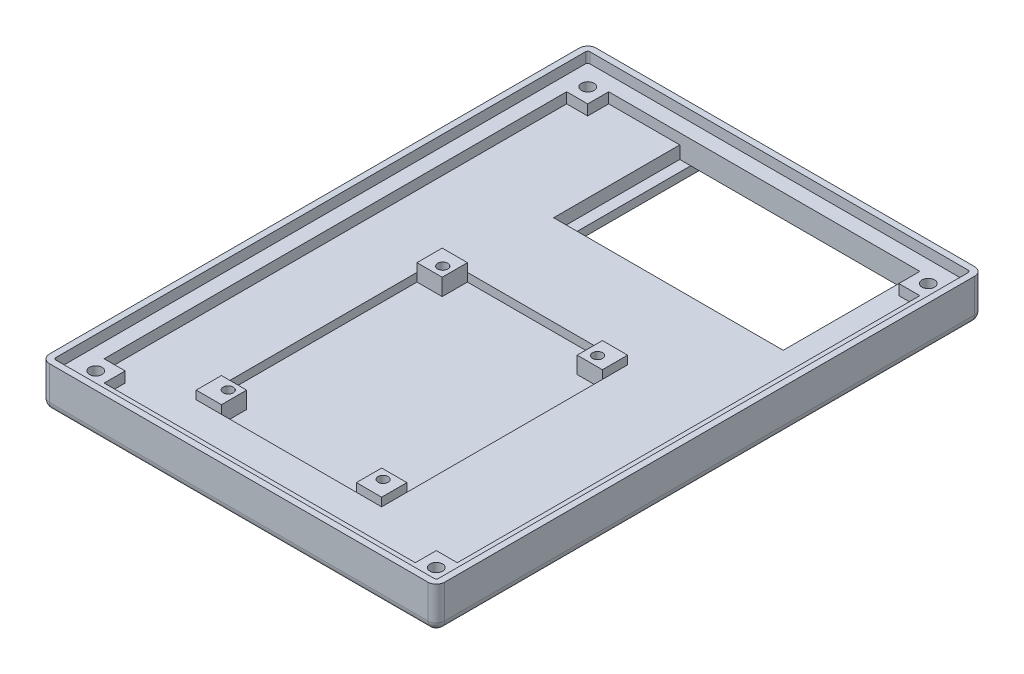
from build123d import *

# Parameters (mm, degrees)
SKETCH1_W           = 94
SKETCH1_H           = 130
BOSS_EXTRUDE1_DEPTH = 5
SKETCH2_W           = 94
SKETCH2_H           = 130
SKETCH2_W_2         = 84
SKETCH2_H_2         = 120
BOSS_EXTRUDE2_DEPTH = 5
FILLET1_R           = 2
SKETCH3_W           = 44.1
SKETCH3_H           = 58.5
CUT_EXTRUDE1_DEPTH  = 2
SKETCH5_W           = 6
SKETCH5_H           = 6
BOSS_EXTRUDE4_DEPTH = 4
SKETCH7_R           = 1.20000014
CUT_EXTRUDE2_DEPTH  = 3
SKETCH8_W           = 54.6
SKETCH8_H           = 30
CUT_EXTRUDE3_DEPTH  = 3
SKETCH9_W           = 49.4
SKETCH9_H           = 27
CUT_EXTRUDE4_DEPTH  = 2
SKETCH10_W          = 49.4
SKETCH10_H          = 6.619549161
CUT_EXTRUDE5_DEPTH  = 2
SKETCH11_W          = 5
SKETCH11_H          = 1
CUT_EXTRUDE6_DEPTH  = 3
SKETCH14_W          = 84
SKETCH14_H          = 120
CUT_EXTRUDE8_DEPTH  = 2.5
SKETCH15_W          = 5
SKETCH15_H          = 5
BOSS_EXTRUDE5_DEPTH = 2.5
SKETCH16_R          = 1.5
CUT_EXTRUDE9_DEPTH  = 161.599657534
SKETCH17_R          = 2.8
CUT_EXTRUDE10_DEPTH = 3


with BuildPart() as part:
    # Sketch1 → Boss-Extrude1 (new body)
    with BuildSketch(Plane(origin=(0, 0, 0), x_dir=(1, 0, 0), z_dir=(0, 1, 0))):
        with Locations((47, 65)):
            Rectangle(SKETCH1_W, SKETCH1_H)
    extrude(amount=BOSS_EXTRUDE1_DEPTH)

    # Sketch2 → Boss-Extrude2 (add)
    with BuildSketch(Plane(origin=(0, 5, 0), x_dir=(1, 0, 0), z_dir=(0, 1, 0))):
        with Locations((47, 65)):
            Rectangle(SKETCH2_W, SKETCH2_H)
        with Locations((47, 65)):
            Rectangle(SKETCH2_W_2, SKETCH2_H_2, mode=Mode.SUBTRACT)
    extrude(amount=BOSS_EXTRUDE2_DEPTH)

    # Fillet1
    fillet1_edges = [part.edges().sort_by_distance(p)[0] for p in [
        (0, 5, -130),
        (0, 5, 0),
        (94, 5, 0),
        (47, 0, 0),
        (0, 0, -65),
        (94, 0, -65),
        (47, 0, -130),
        (94, 5, -130),
    ]]
    fillet(fillet1_edges, radius=FILLET1_R)

    # Sketch3 → Cut-Extrude1 (cut)
    with BuildSketch(Plane(origin=(0, 5, 0), x_dir=(1, 0, 0), z_dir=(0, 1, 0))):
        with Locations((43.95, 44.25)):
            Rectangle(SKETCH3_W, SKETCH3_H)
    extrude(amount=-CUT_EXTRUDE1_DEPTH, mode=Mode.SUBTRACT)

    # Sketch5 → Boss-Extrude4 (add)
    with BuildSketch(Plane(origin=(0, 3, 0), x_dir=(1, 0, 0), z_dir=(0, 1, 0))):
        with Locations((24.9, 70.5)):
            Rectangle(SKETCH5_W, SKETCH5_H)
        with Locations((63, 70.5)):
            Rectangle(SKETCH5_W, SKETCH5_H)
        with Locations((63, 18)):
            Rectangle(SKETCH5_W, SKETCH5_H)
        with Locations((24.9, 18)):
            Rectangle(SKETCH5_W, SKETCH5_H)
    extrude(amount=BOSS_EXTRUDE4_DEPTH)

    # Sketch7 → Cut-Extrude2 (cut)
    with BuildSketch(Plane(origin=(0, 7, 0), x_dir=(1, 0, 0), z_dir=(0, 1, 0))):
        with Locations((25.684600549, 69.839000092)):
            Circle(SKETCH7_R)
        with Locations((62.514600549, 69.839000092)):
            Circle(SKETCH7_R)
        with Locations((62.514600549, 18.835800092)):
            Circle(SKETCH7_R)
        with Locations((25.684600549, 18.835800092)):
            Circle(SKETCH7_R)
    extrude(amount=-CUT_EXTRUDE2_DEPTH, mode=Mode.SUBTRACT)

    # Sketch8 → Cut-Extrude3 (cut)
    with BuildSketch(Plane(origin=(0, 5, 0), x_dir=(1, 0, 0), z_dir=(0, 1, 0))):
        with Locations((54.2, 110)):
            Rectangle(SKETCH8_W, SKETCH8_H)
    extrude(amount=-CUT_EXTRUDE3_DEPTH, mode=Mode.SUBTRACT)

    # Sketch9 → Cut-Extrude4 (cut)
    with BuildSketch(Plane(origin=(0, 2, 0), x_dir=(1, 0, 0), z_dir=(0, 1, 0))):
        with Locations((54.2, 110)):
            Rectangle(SKETCH9_W, SKETCH9_H)
    extrude(amount=-CUT_EXTRUDE4_DEPTH, mode=Mode.SUBTRACT)

    # Sketch10 → Cut-Extrude5 (cut)
    with BuildSketch(Plane.XZ):
        with Locations((54.2, -126.809774581)):
            Rectangle(SKETCH10_W, SKETCH10_H)
    extrude(amount=-CUT_EXTRUDE5_DEPTH, mode=Mode.SUBTRACT)

    # Sketch11 → Cut-Extrude6 (cut)
    with BuildSketch(Plane(origin=(0, 0, -96.5), x_dir=(-1, 0, 0), z_dir=(0, 0, -1))):
        with Locations((-54.2, 1)):
            Rectangle(SKETCH11_W, SKETCH11_H)
    extrude(amount=-CUT_EXTRUDE6_DEPTH, mode=Mode.SUBTRACT)

    # Sketch14 → Cut-Extrude8 (cut)
    with BuildSketch(Plane(origin=(0, 10, 0), x_dir=(1, 0, 0), z_dir=(0, 1, 0))):
        with BuildLine():
            Line((92.5, 2), (92.5, 128))
            ThreePointArc((92.5, 128), (92.353553391, 128.353553391), (92, 128.5))
            Line((92, 128.5), (2, 128.5))
            ThreePointArc((2, 128.5), (1.646446609, 128.353553391), (1.5, 128))
            Line((1.5, 128), (1.5, 2))
            ThreePointArc((1.5, 2), (1.646446609, 1.646446609), (2, 1.5))
            Line((2, 1.5), (92, 1.5))
            ThreePointArc((92, 1.5), (92.353553391, 1.646446609), (92.5, 2))
        make_face()
        with Locations((47, 65)):
            Rectangle(SKETCH14_W, SKETCH14_H, mode=Mode.SUBTRACT)
    extrude(amount=-CUT_EXTRUDE8_DEPTH, mode=Mode.SUBTRACT)

    # Sketch15 → Boss-Extrude5 (add)
    with BuildSketch(Plane(origin=(0, 5, 0), x_dir=(1, 0, 0), z_dir=(0, 1, 0))):
        with Locations((86.5, 122.5)):
            Rectangle(SKETCH15_W, SKETCH15_H)
        with Locations((7.5, 122.5)):
            Rectangle(SKETCH15_W, SKETCH15_H)
        with Locations((7.5, 7.5)):
            Rectangle(SKETCH15_W, SKETCH15_H)
        with Locations((86.5, 7.5)):
            Rectangle(SKETCH15_W, SKETCH15_H)
    extrude(amount=BOSS_EXTRUDE5_DEPTH)

    # Sketch16 → Cut-Extrude9 (cut, through all)
    with BuildSketch(Plane(origin=(0, 7.5, 0), x_dir=(1, 0, 0), z_dir=(0, 1, 0))):
        with Locations((6.5, 123.5)):
            Circle(SKETCH16_R)
        with Locations((87.5, 123.5)):
            Circle(SKETCH16_R)
        with Locations((87.5, 6.5)):
            Circle(SKETCH16_R)
        with Locations((6.5, 6.5)):
            Circle(SKETCH16_R)
    extrude(amount=-CUT_EXTRUDE9_DEPTH, mode=Mode.SUBTRACT)

    # Sketch17 → Cut-Extrude10 (cut)
    with BuildSketch(Plane.XZ):
        with Locations((6.5, -6.5)):
            Circle(SKETCH17_R)
        with Locations((87.5, -6.5)):
            Circle(SKETCH17_R)
        with Locations((87.5, -123.5)):
            Circle(SKETCH17_R)
        with Locations((6.5, -123.5)):
            Circle(SKETCH17_R)
    extrude(amount=-CUT_EXTRUDE10_DEPTH, mode=Mode.SUBTRACT)


solid = part.part
